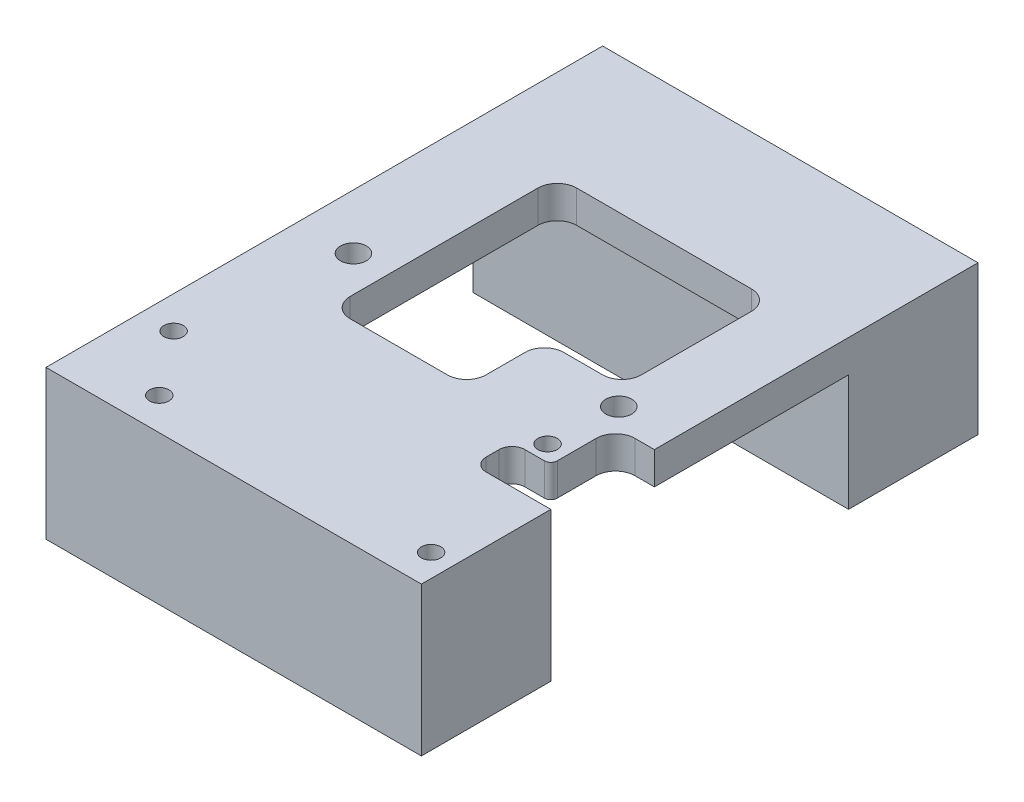
from build123d import *

# Parameters (mm, degrees)
SKETCH1_W               = 58
SKETCH1_H               = 86
BOSS_EXTRUDE1_DEPTH     = 23
CUT_EXTRUDE1_DEPTH      = 23
CUT_EXTRUDE2_DEPTH      = 23
FILLET1_R               = 3
FILLET2_R               = 2
FILLET3_R               = 2
FILLET4_R               = 1
FILLET5_R               = 3
FILLET6_R               = 3
FILLET7_R               = 3
FILLET8_R               = 3
FILLET9_R               = 3
FILLET10_R              = 3
CUT_EXTRUDE3_DEPTH      = 57.73623181
CUT_EXTRUDE3_DEPTH_BACK = 57.73623181
SKETCH4_W               = 46
SKETCH4_H               = 18
CUT_EXTRUDE4_DEPTH      = 57.73623181
CUT_EXTRUDE4_DEPTH_BACK = 57.73623181
SKETCH5_R               = 2
SKETCH5_R_2             = 1.5
SKETCH6_R               = 1.5
CUT_EXTRUDE11_DEPTH     = 10
SKETCH7_R               = 1.5
CUT_EXTRUDE12_DEPTH     = 10


with BuildPart() as part:
    # Sketch1 → Boss-Extrude1 (new body)
    with BuildSketch(Plane(origin=(0, 0, 0), x_dir=(1, 0, 0), z_dir=(0, 1, 0))):
        Rectangle(SKETCH1_W, SKETCH1_H)
    extrude(amount=BOSS_EXTRUDE1_DEPTH)

    # Sketch2 → Cut-Extrude1 (cut)
    with BuildSketch(Plane(origin=(0, 0, 0), x_dir=(1, 0, 0), z_dir=(0, 1, 0))):
        Polygon((29, -23), (17, -23), (17, -17), (23, -17), (23, -7), (29, -7), align=None)
    extrude(amount=CUT_EXTRUDE1_DEPTH, mode=Mode.SUBTRACT)

    # Sketch3 → Cut-Extrude2 (cut)
    with BuildSketch(Plane(origin=(0, 0, 0), x_dir=(1, 0, 0), z_dir=(0, 1, 0))):
        Polygon((-15, -13), (-15, 22), (18, 22), (18, -1), (6, -1), (6, -13), align=None)
    extrude(amount=CUT_EXTRUDE2_DEPTH, mode=Mode.SUBTRACT)

    # Fillet1
    fillet1_edges = [part.edges().sort_by_distance(p)[0] for p in [
        (23, 11.5, 7),
    ]]
    fillet(fillet1_edges, radius=FILLET1_R)

    # Fillet2
    fillet2_edges = [part.edges().sort_by_distance(p)[0] for p in [
        (17, 11.5, 17),
    ]]
    fillet(fillet2_edges, radius=FILLET2_R)

    # Fillet3
    fillet3_edges = [part.edges().sort_by_distance(p)[0] for p in [
        (17, 11.5, 23),
    ]]
    fillet(fillet3_edges, radius=FILLET3_R)

    # Fillet4
    fillet4_edges = [part.edges().sort_by_distance(p)[0] for p in [
        (23, 11.5, 17),
    ]]
    fillet(fillet4_edges, radius=FILLET4_R)

    # Fillet5
    fillet5_edges = [part.edges().sort_by_distance(p)[0] for p in [
        (-15, 11.5, 13),
    ]]
    fillet(fillet5_edges, radius=FILLET5_R)

    # Fillet6
    fillet6_edges = [part.edges().sort_by_distance(p)[0] for p in [
        (6, 11.5, 13),
    ]]
    fillet(fillet6_edges, radius=FILLET6_R)

    # Fillet7
    fillet7_edges = [part.edges().sort_by_distance(p)[0] for p in [
        (-15, 11.5, -22),
    ]]
    fillet(fillet7_edges, radius=FILLET7_R)

    # Fillet8
    fillet8_edges = [part.edges().sort_by_distance(p)[0] for p in [
        (18, 11.5, -22),
    ]]
    fillet(fillet8_edges, radius=FILLET8_R)

    # Fillet9
    fillet9_edges = [part.edges().sort_by_distance(p)[0] for p in [
        (18, 11.5, 1),
    ]]
    fillet(fillet9_edges, radius=FILLET9_R)

    # Fillet10
    fillet10_edges = [part.edges().sort_by_distance(p)[0] for p in [
        (6, 11.5, 1),
    ]]
    fillet(fillet10_edges, radius=FILLET10_R)

    # Sketch4 → Cut-Extrude3 (cut, two sides: drawn at the far end of the back side and taken through both)
    with BuildSketch(Plane(origin=(0, 0, 0), x_dir=(0, 0, -1), z_dir=(1, 0, 0)).offset(-CUT_EXTRUDE3_DEPTH_BACK)):
        with Locations((0, 9)):
            Rectangle(SKETCH4_W, SKETCH4_H)
    extrude(amount=CUT_EXTRUDE3_DEPTH + CUT_EXTRUDE3_DEPTH_BACK, mode=Mode.SUBTRACT)

    # Sketch5 → Cut-Extrude4 (cut, two sides: drawn at the far end of the back side and taken through both)
    with BuildSketch(Plane(origin=(0, 0, 0), x_dir=(1, 0, 0), z_dir=(0, 1, 0)).offset(-CUT_EXTRUDE4_DEPTH_BACK)):
        with Locations((20.5, -4)):
            Circle(SKETCH5_R)
        with Locations((-20.5, -4)):
            Circle(SKETCH5_R)
        with Locations((20, -14.5)):
            Circle(SKETCH5_R_2)
        with Locations((-16.5, -38)):
            Circle(SKETCH5_R_2)
        with Locations((25.5, -38)):
            Circle(SKETCH5_R_2)
        with Locations((-24.000003539, -28.285387332)):
            Circle(SKETCH5_R_2)
    extrude(amount=CUT_EXTRUDE4_DEPTH + CUT_EXTRUDE4_DEPTH_BACK, mode=Mode.SUBTRACT)

    # Sketch6 → Cut-Extrude11 (cut)
    with BuildSketch(Plane.ZY.offset(29)):
        with Locations((40, 3)):
            Circle(SKETCH6_R)
        with Locations((26, 18)):
            Circle(SKETCH6_R)
    extrude(amount=-CUT_EXTRUDE11_DEPTH, mode=Mode.SUBTRACT)

    # Sketch7 → Cut-Extrude12 (cut)
    with BuildSketch(Plane(origin=(0, 0, -43), x_dir=(-1, 0, 0), z_dir=(0, 0, -1))):
        with Locations((-19.5, 4.5)):
            Circle(SKETCH7_R)
        with Locations((-19.5, 18.5)):
            Circle(SKETCH7_R)
    extrude(amount=-CUT_EXTRUDE12_DEPTH, mode=Mode.SUBTRACT)


solid = part.part
